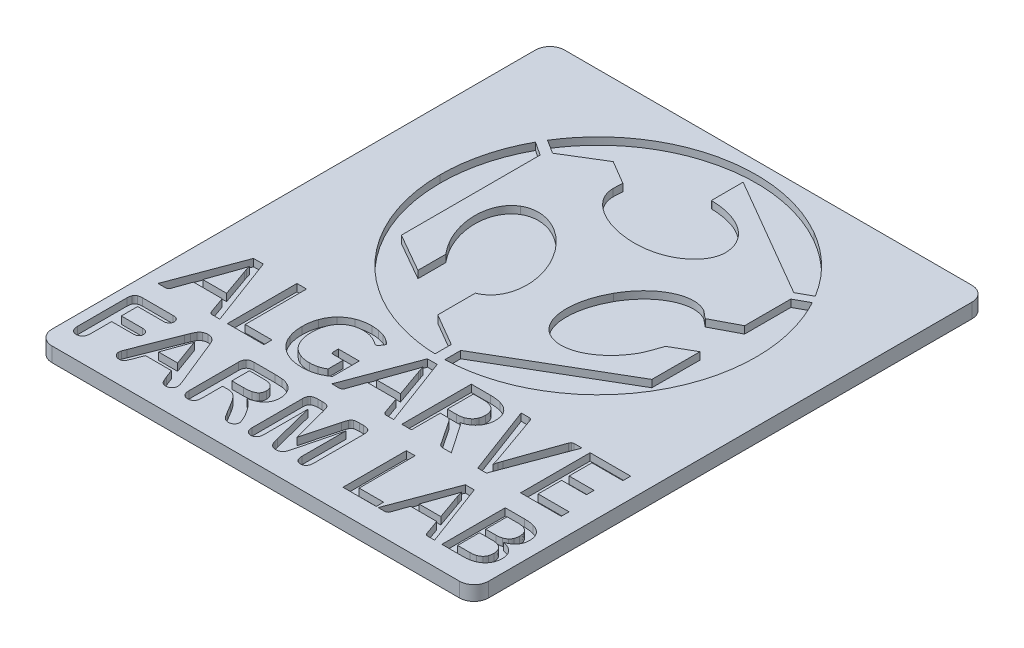
from build123d import *

# Parameters (mm, degrees)
BOSS_EXTRUDE1_DEPTH   = 0.5
BOSS_EXTRUDE1_2_DEPTH = 0.5
BOSS_EXTRUDE1_3_DEPTH = 0.5
BOSS_EXTRUDE1_4_DEPTH = 0.5
BOSS_EXTRUDE1_5_DEPTH = 0.5
BOSS_EXTRUDE1_6_DEPTH = 0.5
BOSS_EXTRUDE1_7_DEPTH = 0.5
BOSS_EXTRUDE1_8_DEPTH = 0.5
BOSS_EXTRUDE1_9_DEPTH = 0.5
BOSS_EXTRUDE2_DEPTH   = 0.5


with BuildPart() as part:
    # Sketch2 → Boss-Extrude1 (new body)
    with BuildSketch(Plane(origin=(0, 0, 0), x_dir=(1, 0, 0), z_dir=(0, 1, 0))):
        Polygon((124.769989054, 295.813345853), (124.120719075, 294.003169154), (125.431226892, 294.003169154), align=None)
    extrude(amount=BOSS_EXTRUDE1_DEPTH)



with BuildPart() as body_2:
    # Sketch2 → Boss-Extrude1 2 (new body)
    with BuildSketch(Plane(origin=(0, 0, 0), x_dir=(1, 0, 0), z_dir=(0, 1, 0))):
        with BuildLine():
            add(Edge.make_bspline(
                [(129.793601653, 295.942002339), (129.689877921, 295.985886013), (129.485422708, 296.00782766), (129.180235632, 296.00782766)],
                knots=[0, 0, 0, 0, 1, 1, 1, 1], degree=3))
            Line((129.180235632, 296.00782766), (128.360420708, 296.00782766))
            Line((128.360420708, 296.00782766), (128.360420708, 294.802040992))
            Line((128.360420708, 294.802040992), (129.156299152, 294.802040992))
            add(Edge.make_bspline(
                [(129.156299152, 294.802040992), (129.369730736, 294.802040992), (129.549252433, 294.819992971), (129.694864243, 294.855896929)],
                knots=[0, 0, 0, 0, 1, 1, 1, 1], degree=3))
            add(Edge.make_bspline(
                [(129.694864243, 294.855896929), (129.840476434, 294.893796103), (129.951181703, 294.956629173), (130.026979668, 295.044394997)],
                knots=[0, 0, 0, 0, 1, 1, 1, 1], degree=3))
            add(Edge.make_bspline(
                [(130.026979668, 295.044394997), (130.104772086, 295.134155274), (130.143668295, 295.256828021), (130.143668295, 295.412413619)],
                knots=[0, 0, 0, 0, 1, 1, 1, 1], degree=3))
            add(Edge.make_bspline(
                [(130.143668295, 295.412413619), (130.143668295, 295.53408933), (130.112750659, 295.640804931), (130.050915387, 295.732561185)],
                knots=[0, 0, 0, 0, 1, 1, 1, 1], degree=3))
            add(Edge.make_bspline(
                [(130.050915387, 295.732561185), (129.989080114, 295.826311129), (129.903308743, 295.896124974), (129.793601653, 295.942002339)],
                knots=[0, 0, 0, 0, 1, 1, 1, 1], degree=3))
        make_face()
    extrude(amount=BOSS_EXTRUDE1_2_DEPTH)


with BuildPart() as body_3:
    # Sketch2 → Boss-Extrude1 3 (new body)
    with BuildSketch(Plane(origin=(0, 0, 0), x_dir=(1, 0, 0), z_dir=(0, 1, 0))):
        with BuildLine():
            Line((142.737843878, 295.656010395), (142.121394171, 293.906089407))
            Line((142.121394171, 293.906089407), (143.612804753, 293.906089407))
            Line((143.612804753, 293.906089407), (142.996355427, 295.659325339))
            add(Edge.make_bspline(
                [(142.996355427, 295.659325339), (142.974260243, 295.712353398), (142.95216506, 295.774219149), (142.930069877, 295.844922973)],
                knots=[0, 0, 0, 0, 1, 1, 1, 1], degree=3))
            add(Edge.make_bspline(
                [(142.930069877, 295.844922973), (142.907975456, 295.915626417), (142.886985508, 295.991854132), (142.867099652, 296.073605358)],
                knots=[0, 0, 0, 0, 1, 1, 1, 1], degree=3))
            add(Edge.make_bspline(
                [(142.867099652, 296.073605358), (142.845004469, 295.989644804), (142.822909667, 295.912312234), (142.800815246, 295.841608029)],
                knots=[0, 0, 0, 0, 1, 1, 1, 1], degree=3))
            add(Edge.make_bspline(
                [(142.800815246, 295.841608029), (142.778720062, 295.770904205), (142.757729733, 295.709038453), (142.737843878, 295.656010395)],
                knots=[0, 0, 0, 0, 1, 1, 1, 1], degree=3))
        make_face()
    extrude(amount=BOSS_EXTRUDE1_3_DEPTH)


with BuildPart() as body_4:
    # Sketch2 → Boss-Extrude1 4 (new body)
    with BuildSketch(Plane(origin=(0, 0, 0), x_dir=(1, 0, 0), z_dir=(0, 1, 0))):
        with BuildLine():
            Line((146.764651496, 294.270656692), (145.906262676, 294.270656692))
            Line((145.906262676, 294.270656692), (145.906262676, 292.765989382))
            Line((145.906262676, 292.765989382), (146.764651496, 292.765989382))
            add(Edge.make_bspline(
                [(146.764651496, 292.765989382), (146.917107308, 292.765989382), (147.047467556, 292.784770383), (147.155732239, 292.822332004)],
                knots=[0, 0, 0, 0, 1, 1, 1, 1], degree=3))
            add(Edge.make_bspline(
                [(147.155732239, 292.822332004), (147.266207013, 292.862102572), (147.355691838, 292.916234723), (147.424186335, 292.984729219)],
                knots=[0, 0, 0, 0, 1, 1, 1, 1], degree=3))
            add(Edge.make_bspline(
                [(147.424186335, 292.984729219), (147.494890159, 293.053223716), (147.545708509, 293.134975322), (147.576642146, 293.229983277)],
                knots=[0, 0, 0, 0, 1, 1, 1, 1], degree=3))
            add(Edge.make_bspline(
                [(147.576642146, 293.229983277), (147.609783969, 293.327201321), (147.62635488, 293.432152584), (147.62635488, 293.544837447)],
                knots=[0, 0, 0, 0, 1, 1, 1, 1], degree=3))
            add(Edge.make_bspline(
                [(147.62635488, 293.544837447), (147.62635488, 293.767996322), (147.555651056, 293.944755883), (147.414243788, 294.075116511)],
                knots=[0, 0, 0, 0, 1, 1, 1, 1], degree=3))
            add(Edge.make_bspline(
                [(147.414243788, 294.075116511), (147.275045467, 294.205476378), (147.058514576, 294.270656692), (146.764651496, 294.270656692)],
                knots=[0, 0, 0, 0, 1, 1, 1, 1], degree=3))
        make_face()
    extrude(amount=BOSS_EXTRUDE1_4_DEPTH)


with BuildPart() as body_5:
    # Sketch2 → Boss-Extrude1 5 (new body)
    with BuildSketch(Plane(origin=(0, 0, 0), x_dir=(1, 0, 0), z_dir=(0, 1, 0))):
        with BuildLine():
            Line((145.906262676, 296.169718547), (145.906262676, 294.69488002))
            Line((145.906262676, 294.69488002), (146.608881883, 294.69488002))
            add(Edge.make_bspline(
                [(146.608881883, 294.69488002), (146.756918277, 294.69488002), (146.886174052, 294.712556166), (146.996648825, 294.747908079)],
                knots=[0, 0, 0, 0, 1, 1, 1, 1], degree=3))
            add(Edge.make_bspline(
                [(146.996648825, 294.747908079), (147.107123598, 294.785468938), (147.198817751, 294.836287288), (147.271731666, 294.900362748)],
                knots=[0, 0, 0, 0, 1, 1, 1, 1], degree=3))
            add(Edge.make_bspline(
                [(147.271731666, 294.900362748), (147.344644437, 294.964437826), (147.398776969, 295.041770396), (147.434128881, 295.132360076)],
                knots=[0, 0, 0, 0, 1, 1, 1, 1], degree=3))
            add(Edge.make_bspline(
                [(147.434128881, 295.132360076), (147.471690502, 295.222949756), (147.490471503, 295.323481982), (147.490471503, 295.433956756)],
                knots=[0, 0, 0, 0, 1, 1, 1, 1], degree=3))
            add(Edge.make_bspline(
                [(147.490471503, 295.433956756), (147.490471503, 295.688048125), (147.420872533, 295.873645759), (147.281674212, 295.990749659)],
                knots=[0, 0, 0, 0, 1, 1, 1, 1], degree=3))
            add(Edge.make_bspline(
                [(147.281674212, 295.990749659), (147.144685219, 296.110062124), (146.928154328, 296.169718547), (146.632081921, 296.169718547)],
                knots=[0, 0, 0, 0, 1, 1, 1, 1], degree=3))
            Line((146.632081921, 296.169718547), (145.906262676, 296.169718547))
        make_face()
    extrude(amount=BOSS_EXTRUDE1_5_DEPTH)


with BuildPart() as body_6:
    # Sketch2 → Boss-Extrude1 6 (new body)
    with BuildSketch(Plane(origin=(0, 0, 0), x_dir=(1, 0, 0), z_dir=(0, 1, 0))):
        with BuildLine():
            Line((122.009482463, 301.751258761), (121.333550182, 299.832485982))
            Line((121.333550182, 299.832485982), (122.968869454, 299.832485982))
            Line((122.968869454, 299.832485982), (122.292937173, 301.75489295))
            add(Edge.make_bspline(
                [(122.292937173, 301.75489295), (122.268710182, 301.813037968), (122.244483592, 301.880873623), (122.220256601, 301.958399512)],
                knots=[0, 0, 0, 0, 1, 1, 1, 1], degree=3))
            add(Edge.make_bspline(
                [(122.220256601, 301.958399512), (122.196029611, 302.035925802), (122.17301415, 302.11950854), (122.151210219, 302.209148125)],
                knots=[0, 0, 0, 0, 1, 1, 1, 1], degree=3))
            add(Edge.make_bspline(
                [(122.151210219, 302.209148125), (122.126982827, 302.117085881), (122.102755435, 302.032291613), (122.078528846, 301.954765323)],
                knots=[0, 0, 0, 0, 1, 1, 1, 1], degree=3))
            add(Edge.make_bspline(
                [(122.078528846, 301.954765323), (122.054301855, 301.877239033), (122.031286394, 301.809403779), (122.009482463, 301.751258761)],
                knots=[0, 0, 0, 0, 1, 1, 1, 1], degree=3))
        make_face()
    extrude(amount=BOSS_EXTRUDE1_6_DEPTH)


with BuildPart() as body_7:
    # Sketch2 → Boss-Extrude1 7 (new body)
    with BuildSketch(Plane(origin=(0, 0, 0), x_dir=(1, 0, 0), z_dir=(0, 1, 0))):
        with BuildLine():
            Line((133.958206973, 301.751258761), (133.282274692, 299.832485982))
            Line((133.282274692, 299.832485982), (134.917592761, 299.832485982))
            Line((134.917592761, 299.832485982), (134.241661683, 301.75489295))
            add(Edge.make_bspline(
                [(134.241661683, 301.75489295), (134.217435093, 301.813037968), (134.193208102, 301.880873623), (134.168981112, 301.958399512)],
                knots=[0, 0, 0, 0, 1, 1, 1, 1], degree=3))
            add(Edge.make_bspline(
                [(134.168981112, 301.958399512), (134.144754522, 302.035925802), (134.12173866, 302.11950854), (134.099933927, 302.209148125)],
                knots=[0, 0, 0, 0, 1, 1, 1, 1], degree=3))
            add(Edge.make_bspline(
                [(134.099933927, 302.209148125), (134.075706936, 302.117085881), (134.051480347, 302.032291613), (134.027253356, 301.954765323)],
                knots=[0, 0, 0, 0, 1, 1, 1, 1], degree=3))
            add(Edge.make_bspline(
                [(134.027253356, 301.954765323), (134.003026365, 301.877239033), (133.980011305, 301.809403779), (133.958206973, 301.751258761)],
                knots=[0, 0, 0, 0, 1, 1, 1, 1], degree=3))
        make_face()
    extrude(amount=BOSS_EXTRUDE1_7_DEPTH)


with BuildPart() as body_8:
    # Sketch2 → Boss-Extrude1 8 (new body)
    with BuildSketch(Plane(origin=(0, 0, 0), x_dir=(1, 0, 0), z_dir=(0, 1, 0))):
        with BuildLine():
            Line((137.443251438, 302.314534793), (137.443251438, 300.526587203))
            Line((137.443251438, 300.526587203), (138.064672489, 300.526587203))
            add(Edge.make_bspline(
                [(138.064672489, 300.526587203), (138.239106743, 300.526587203), (138.391736664, 300.548391535), (138.522561853, 300.592000199)],
                knots=[0, 0, 0, 0, 1, 1, 1, 1], degree=3))
            add(Edge.make_bspline(
                [(138.522561853, 300.592000199), (138.655810503, 300.63803112), (138.76725442, 300.702232586), (138.856894005, 300.784604194)],
                knots=[0, 0, 0, 0, 1, 1, 1, 1], degree=3))
            add(Edge.make_bspline(
                [(138.856894005, 300.784604194), (138.946533591, 300.866975401), (139.013157314, 300.965094494), (139.056765176, 301.078961872)],
                knots=[0, 0, 0, 0, 1, 1, 1, 1], degree=3))
            add(Edge.make_bspline(
                [(139.056765176, 301.078961872), (139.102796899, 301.195251107), (139.125812761, 301.322442107), (139.125812761, 301.460535673)],
                knots=[0, 0, 0, 0, 1, 1, 1, 1], degree=3))
            add(Edge.make_bspline(
                [(139.125812761, 301.460535673), (139.125812761, 302.029868152), (138.780578844, 302.314534793), (138.09011101, 302.314534793)],
                knots=[0, 0, 0, 0, 1, 1, 1, 1], degree=3))
            Line((138.09011101, 302.314534793), (137.443251438, 302.314534793))
        make_face()
    extrude(amount=BOSS_EXTRUDE1_8_DEPTH)


with BuildPart() as body_9:
    # Sketch2 → Boss-Extrude1 9 (new body)
    with BuildSketch(Plane(origin=(0, 0, 0), x_dir=(1, 0, 0), z_dir=(0, 1, 0))):
        with BuildLine():
            Line((148.101751423, 325.918895246), (120.101751423, 325.918895246))
            ThreePointArc((120.101751423, 325.918895246), (119.394644642, 325.626002027), (119.101751423, 324.918895246))
            Line((119.101751423, 324.918895246), (119.101751423, 291.701733425))
            ThreePointArc((119.101751423, 291.701733425), (119.394644642, 290.994626643), (120.101751423, 290.701733425))
            Line((120.101751423, 290.701733425), (148.101751423, 290.701733425))
            ThreePointArc((148.101751423, 290.701733425), (148.808858204, 290.994626643), (149.101751423, 291.701733425))
            Line((149.101751423, 291.701733425), (149.101751423, 324.918895246))
            ThreePointArc((149.101751423, 324.918895246), (148.808858204, 325.626002027), (148.101751423, 325.918895246))
        make_face()
        with BuildLine():
            add(Edge.make_bspline(
                [(122.765331691, 296.082627446), (122.697512299, 296.020792174), (122.592791531, 295.989874538), (122.451169007, 295.989874538)],
                knots=[0, 0, 0, 0, 1, 1, 1, 1], degree=3))
            Line((122.451169007, 295.989874538), (120.700832747, 295.989874538))
            Line((120.700832747, 295.989874538), (120.700832747, 294.86786517))
            Line((120.700832747, 294.86786517), (122.163933911, 294.86786517))
            add(Edge.make_bspline(
                [(122.163933911, 294.86786517), (122.299572696, 294.86786517), (122.400304177, 294.836947533), (122.466128355, 294.775112261)],
                knots=[0, 0, 0, 0, 1, 1, 1, 1], degree=3))
            add(Edge.make_bspline(
                [(122.466128355, 294.775112261), (122.533947747, 294.715271822), (122.567857253, 294.634487154), (122.567857253, 294.532758256)],
                knots=[0, 0, 0, 0, 1, 1, 1, 1], degree=3))
            add(Edge.make_bspline(
                [(122.567857253, 294.532758256), (122.567857253, 294.431028977), (122.533947747, 294.350244308), (122.466128355, 294.29040387)],
                knots=[0, 0, 0, 0, 1, 1, 1, 1], degree=3))
            add(Edge.make_bspline(
                [(122.466128355, 294.29040387), (122.398308962, 294.230563812), (122.297577481, 294.200643593), (122.163933911, 294.200643593)],
                knots=[0, 0, 0, 0, 1, 1, 1, 1], degree=3))
            Line((122.163933911, 294.200643593), (120.700832747, 294.200643593))
            Line((120.700832747, 294.200643593), (120.700832747, 292.755494027))
            add(Edge.make_bspline(
                [(120.700832747, 292.755494027), (120.700832747, 292.571983043), (120.658944668, 292.435347223), (120.57516813, 292.345586946)],
                knots=[0, 0, 0, 0, 1, 1, 1, 1], degree=3))
            add(Edge.make_bspline(
                [(120.57516813, 292.345586946), (120.493386045, 292.257821121), (120.387667861, 292.213937828), (120.258013196, 292.213937828)],
                knots=[0, 0, 0, 0, 1, 1, 1, 1], degree=3))
            add(Edge.make_bspline(
                [(120.258013196, 292.213937828), (120.126363697, 292.213937828), (120.018650679, 292.258818157), (119.934874522, 292.348578434)],
                knots=[0, 0, 0, 0, 1, 1, 1, 1], degree=3))
            add(Edge.make_bspline(
                [(119.934874522, 292.348578434), (119.853092437, 292.438339473), (119.812201394, 292.573977877), (119.812201394, 292.755494027)],
                knots=[0, 0, 0, 0, 1, 1, 1, 1], degree=3))
            Line((119.812201394, 292.755494027), (119.812201394, 296.130500788))
            add(Edge.make_bspline(
                [(119.812201394, 296.130500788), (119.812201394, 296.258160619), (119.83115079, 296.36188397), (119.869049583, 296.441671221)],
                knots=[0, 0, 0, 0, 1, 1, 1, 1], degree=3))
            add(Edge.make_bspline(
                [(119.869049583, 296.441671221), (119.906948756, 296.523453307), (119.965792158, 296.582296328), (120.04557941, 296.618200287)],
                knots=[0, 0, 0, 0, 1, 1, 1, 1], degree=3))
            add(Edge.make_bspline(
                [(120.04557941, 296.618200287), (120.127361495, 296.65609946), (120.231084846, 296.675049237), (120.356749844, 296.675049237)],
                knots=[0, 0, 0, 0, 1, 1, 1, 1], degree=3))
            Line((120.356749844, 296.675049237), (122.451169007, 296.675049237))
            add(Edge.make_bspline(
                [(122.451169007, 296.675049237), (122.592791531, 296.675049237), (122.697512299, 296.643134184), (122.765331691, 296.579304078)],
                knots=[0, 0, 0, 0, 1, 1, 1, 1], degree=3))
            add(Edge.make_bspline(
                [(122.765331691, 296.579304078), (122.835145155, 296.517468805), (122.870051697, 296.435686339), (122.870051697, 296.333957441)],
                knots=[0, 0, 0, 0, 1, 1, 1, 1], degree=3))
            add(Edge.make_bspline(
                [(122.870051697, 296.333957441), (122.870051697, 296.230234471), (122.835145155, 296.146457933), (122.765331691, 296.082627446)],
                knots=[0, 0, 0, 0, 1, 1, 1, 1], degree=3))
        make_face(mode=Mode.SUBTRACT)
        with BuildLine():
            add(Edge.make_bspline(
                [(125.978767972, 292.549045123), (125.940868418, 292.6388054), (125.907955948, 292.717594854), (125.880030182, 292.785414246)],
                knots=[0, 0, 0, 0, 1, 1, 1, 1], degree=3))
            Line((125.880030182, 292.785414246), (125.670588646, 293.335947577))
            Line((125.670588646, 293.335947577), (123.887341059, 293.335947577))
            Line((123.887341059, 293.335947577), (123.677898762, 292.773446006))
            add(Edge.make_bspline(
                [(123.677898762, 292.773446006), (123.596117058, 292.554031064), (123.526303213, 292.405427003), (123.468457227, 292.327634204)],
                knots=[0, 0, 0, 0, 1, 1, 1, 1], degree=3))
            add(Edge.make_bspline(
                [(123.468457227, 292.327634204), (123.410611622, 292.25183662), (123.31586426, 292.213937828), (123.184214762, 292.213937828)],
                knots=[0, 0, 0, 0, 1, 1, 1, 1], degree=3))
            add(Edge.make_bspline(
                [(123.184214762, 292.213937828), (123.072512457, 292.213937828), (122.97377581, 292.254828871), (122.888003676, 292.336611337)],
                knots=[0, 0, 0, 0, 1, 1, 1, 1], degree=3))
            add(Edge.make_bspline(
                [(122.888003676, 292.336611337), (122.802232685, 292.41839266), (122.759346809, 292.511145188), (122.759346809, 292.61486892)],
                knots=[0, 0, 0, 0, 1, 1, 1, 1], degree=3))
            add(Edge.make_bspline(
                [(122.759346809, 292.61486892), (122.759346809, 292.674709358), (122.769320216, 292.736544631), (122.789267028, 292.800375118)],
                knots=[0, 0, 0, 0, 1, 1, 1, 1], degree=3))
            add(Edge.make_bspline(
                [(122.789267028, 292.800375118), (122.809213841, 292.864204462), (122.842126311, 292.952968084), (122.888003676, 293.066665603)],
                knots=[0, 0, 0, 0, 1, 1, 1, 1], degree=3))
            Line((122.888003676, 293.066665603), (124.010014187, 295.915074751))
            add(Edge.make_bspline(
                [(124.010014187, 295.915074751), (124.04192924, 295.996856837), (124.079828032, 296.094596067), (124.123711706, 296.208293206)],
                knots=[0, 0, 0, 0, 1, 1, 1, 1], degree=3))
            add(Edge.make_bspline(
                [(124.123711706, 296.208293206), (124.169589071, 296.323984797), (124.21746127, 296.419729956), (124.267327921, 296.495527921)],
                knots=[0, 0, 0, 0, 1, 1, 1, 1], degree=3))
            add(Edge.make_bspline(
                [(124.267327921, 296.495527921), (124.319190168, 296.571325505), (124.386012525, 296.632163361), (124.46779461, 296.678041487)],
                knots=[0, 0, 0, 0, 1, 1, 1, 1], degree=3))
            add(Edge.make_bspline(
                [(124.46779461, 296.678041487), (124.551570767, 296.725913305), (124.654296701, 296.749849404), (124.775972412, 296.749849404)],
                knots=[0, 0, 0, 0, 1, 1, 1, 1], degree=3))
            add(Edge.make_bspline(
                [(124.775972412, 296.749849404), (124.899643337, 296.749849404), (125.002369652, 296.725913305), (125.084151738, 296.678041487)],
                knots=[0, 0, 0, 0, 1, 1, 1, 1], degree=3))
            add(Edge.make_bspline(
                [(125.084151738, 296.678041487), (125.167927895, 296.632163361), (125.23474987, 296.572322541), (125.284617283, 296.498519409)],
                knots=[0, 0, 0, 0, 1, 1, 1, 1], degree=3))
            add(Edge.make_bspline(
                [(125.284617283, 296.498519409), (125.336478768, 296.424715897), (125.379364264, 296.344928645), (125.41327415, 296.259157655)],
                knots=[0, 0, 0, 0, 1, 1, 1, 1], degree=3))
            add(Edge.make_bspline(
                [(125.41327415, 296.259157655), (125.44917849, 296.175380736), (125.4940592, 296.062680633), (125.547915518, 295.921058109)],
                knots=[0, 0, 0, 0, 1, 1, 1, 1], degree=3))
            Line((125.547915518, 295.921058109), (126.693861748, 293.090600941))
            add(Edge.make_bspline(
                [(126.693861748, 293.090600941), (126.783622787, 292.875175285), (126.828503116, 292.718592652), (126.828503116, 292.620853802)],
                knots=[0, 0, 0, 0, 1, 1, 1, 1], degree=3))
            add(Edge.make_bspline(
                [(126.828503116, 292.620853802), (126.828503116, 292.519124904), (126.785617621, 292.425374197), (126.699846249, 292.339602445)],
                knots=[0, 0, 0, 0, 1, 1, 1, 1], degree=3))
            add(Edge.make_bspline(
                [(126.699846249, 292.339602445), (126.61606933, 292.255826288), (126.514340432, 292.213937828), (126.394659554, 292.213937828)],
                knots=[0, 0, 0, 0, 1, 1, 1, 1], degree=3))
            add(Edge.make_bspline(
                [(126.394659554, 292.213937828), (126.324845328, 292.213937828), (126.265004509, 292.226903485), (126.215137095, 292.252834037)],
                knots=[0, 0, 0, 0, 1, 1, 1, 1], degree=3))
            add(Edge.make_bspline(
                [(126.215137095, 292.252834037), (126.165270444, 292.276770136), (126.123382366, 292.309682225), (126.08947286, 292.351570685)],
                knots=[0, 0, 0, 0, 1, 1, 1, 1], degree=3))
            add(Edge.make_bspline(
                [(126.08947286, 292.351570685), (126.055562973, 292.395453978), (126.018661598, 292.461278918), (125.978767972, 292.549045123)],
                knots=[0, 0, 0, 0, 1, 1, 1, 1], degree=3))
        make_face(mode=Mode.SUBTRACT)
        with BuildLine():
            add(Edge.make_bspline(
                [(129.063547386, 294.101906945), (128.959823655, 294.143794642), (128.829171573, 294.164738491), (128.671591142, 294.164738491)],
                knots=[0, 0, 0, 0, 1, 1, 1, 1], degree=3))
            Line((128.671591142, 294.164738491), (128.360420708, 294.164738491))
            Line((128.360420708, 294.164738491), (128.360420708, 292.755494027))
            add(Edge.make_bspline(
                [(128.360420708, 292.755494027), (128.360420708, 292.569988972), (128.319529665, 292.433353151), (128.23774758, 292.345586946)],
                knots=[0, 0, 0, 0, 1, 1, 1, 1], degree=3))
            add(Edge.make_bspline(
                [(128.23774758, 292.345586946), (128.155965495, 292.257821121), (128.049249513, 292.213937828), (127.917600014, 292.213937828)],
                knots=[0, 0, 0, 0, 1, 1, 1, 1], degree=3))
            add(Edge.make_bspline(
                [(127.917600014, 292.213937828), (127.77597749, 292.213937828), (127.666270019, 292.259815574), (127.588477601, 292.351570685)],
                knots=[0, 0, 0, 0, 1, 1, 1, 1], degree=3))
            add(Edge.make_bspline(
                [(127.588477601, 292.351570685), (127.510684803, 292.443325795), (127.471788213, 292.577967163), (127.471788213, 292.755494027)],
                knots=[0, 0, 0, 0, 1, 1, 1, 1], degree=3))
            Line((127.471788213, 292.755494027), (127.471788213, 296.130500788))
            add(Edge.make_bspline(
                [(127.471788213, 296.130500788), (127.471788213, 296.321989963), (127.514674089, 296.460620617), (127.600446223, 296.54639237)],
                knots=[0, 0, 0, 0, 1, 1, 1, 1], degree=3))
            add(Edge.make_bspline(
                [(127.600446223, 296.54639237), (127.686217213, 296.632163742), (127.824847868, 296.675049237), (128.016337805, 296.675049237)],
                knots=[0, 0, 0, 0, 1, 1, 1, 1], degree=3))
            Line((128.016337805, 296.675049237), (129.461485847, 296.675049237))
            add(Edge.make_bspline(
                [(129.461485847, 296.675049237), (129.660954737, 296.675049237), (129.831500445, 296.666073247), (129.973122969, 296.648121268)],
                knots=[0, 0, 0, 0, 1, 1, 1, 1], degree=3))
            add(Edge.make_bspline(
                [(129.973122969, 296.648121268), (130.114745493, 296.632163742), (130.242405324, 296.598253855), (130.356102081, 296.54639237)],
                knots=[0, 0, 0, 0, 1, 1, 1, 1], degree=3))
            add(Edge.make_bspline(
                [(130.356102081, 296.54639237), (130.4937357, 296.488546384), (130.615411411, 296.405766501), (130.721129214, 296.298053864)],
                knots=[0, 0, 0, 0, 1, 1, 1, 1], degree=3))
            add(Edge.make_bspline(
                [(130.721129214, 296.298053864), (130.826848161, 296.190340845), (130.906635793, 296.064675848), (130.960492112, 295.921058109)],
                knots=[0, 0, 0, 0, 1, 1, 1, 1], degree=3))
            add(Edge.make_bspline(
                [(130.960492112, 295.921058109), (131.016342883, 295.779435585), (131.044267888, 295.628837072), (131.044267888, 295.469262569)],
                knots=[0, 0, 0, 0, 1, 1, 1, 1], degree=3))
            add(Edge.make_bspline(
                [(131.044267888, 295.469262569), (131.044267888, 295.142134228), (130.95151536, 294.880830446), (130.766010305, 294.685351603)],
                knots=[0, 0, 0, 0, 1, 1, 1, 1], degree=3))
            add(Edge.make_bspline(
                [(130.766010305, 294.685351603), (130.582499322, 294.489872379), (130.303243179, 294.351242106), (129.928242259, 294.26945964)],
                knots=[0, 0, 0, 0, 1, 1, 1, 1], degree=3))
            add(Edge.make_bspline(
                [(129.928242259, 294.26945964), (130.085822309, 294.185682721), (130.236421204, 294.062012557), (130.380038561, 293.898449149)],
                knots=[0, 0, 0, 0, 1, 1, 1, 1], degree=3))
            add(Edge.make_bspline(
                [(130.380038561, 293.898449149), (130.5236563, 293.734884597), (130.65131575, 293.560349603), (130.763017674, 293.374843786)],
                knots=[0, 0, 0, 0, 1, 1, 1, 1], degree=3))
            add(Edge.make_bspline(
                [(130.763017674, 293.374843786), (130.876714812, 293.191332422), (130.964481017, 293.024776382), (131.02631629, 292.875174904)],
                knots=[0, 0, 0, 0, 1, 1, 1, 1], degree=3))
            add(Edge.make_bspline(
                [(131.02631629, 292.875174904), (131.090146396, 292.72756826), (131.122061449, 292.625839743), (131.122061449, 292.569989353)],
                knots=[0, 0, 0, 0, 1, 1, 1, 1], degree=3))
            add(Edge.make_bspline(
                [(131.122061449, 292.569989353), (131.122061449, 292.512142986), (131.103111672, 292.454297), (131.065212499, 292.396451395)],
                knots=[0, 0, 0, 0, 1, 1, 1, 1], degree=3))
            add(Edge.make_bspline(
                [(131.065212499, 292.396451395), (131.02930854, 292.340600242), (130.979441508, 292.29671733), (130.915611402, 292.264802277)],
                knots=[0, 0, 0, 0, 1, 1, 1, 1], degree=3))
            add(Edge.make_bspline(
                [(130.915611402, 292.264802277), (130.851780915, 292.230892772), (130.777977783, 292.213937828), (130.694201626, 292.213937828)],
                knots=[0, 0, 0, 0, 1, 1, 1, 1], degree=3))
            add(Edge.make_bspline(
                [(130.694201626, 292.213937828), (130.594467562, 292.213937828), (130.510690643, 292.237874308), (130.442871632, 292.285746507)],
                knots=[0, 0, 0, 0, 1, 1, 1, 1], degree=3))
            add(Edge.make_bspline(
                [(130.442871632, 292.285746507), (130.375052239, 292.331624253), (130.316208836, 292.390467275), (130.266341423, 292.462275572)],
                knots=[0, 0, 0, 0, 1, 1, 1, 1], degree=3))
            add(Edge.make_bspline(
                [(130.266341423, 292.462275572), (130.218468844, 292.534084632), (130.152644285, 292.639803198), (130.068867366, 292.779430888)],
                knots=[0, 0, 0, 0, 1, 1, 1, 1], degree=3))
            Line((130.068867366, 292.779430888), (129.712816984, 293.371851155))
            add(Edge.make_bspline(
                [(129.712816984, 293.371851155), (129.585156772, 293.589272025), (129.470461836, 293.754831029), (129.368732938, 293.868528929)],
                knots=[0, 0, 0, 0, 1, 1, 1, 1], degree=3))
            add(Edge.make_bspline(
                [(129.368732938, 293.868528929), (129.268998874, 293.982225687), (129.167270356, 294.060018485), (129.063547386, 294.101906945)],
                knots=[0, 0, 0, 0, 1, 1, 1, 1], degree=3))
        make_face(mode=Mode.SUBTRACT)
        with BuildLine():
            add(Edge.make_bspline(
                [(133.431905506, 292.683685348), (133.409963859, 292.769457482), (133.387025177, 292.858220723), (133.363089077, 292.949975833)],
                knots=[0, 0, 0, 0, 1, 1, 1, 1], degree=3))
            Line((133.363089077, 292.949975833), (132.65996278, 295.744529425))
            Line((132.65996278, 295.744529425), (132.65996278, 292.716597818))
            add(Edge.make_bspline(
                [(132.65996278, 292.716597818), (132.65996278, 292.549044742), (132.622063607, 292.423379364), (132.546265261, 292.339602445)],
                knots=[0, 0, 0, 0, 1, 1, 1, 1], degree=3))
            add(Edge.make_bspline(
                [(132.546265261, 292.339602445), (132.472462129, 292.255826288), (132.373725101, 292.213937828), (132.250054556, 292.213937828)],
                knots=[0, 0, 0, 0, 1, 1, 1, 1], degree=3))
            add(Edge.make_bspline(
                [(132.250054556, 292.213937828), (132.130373679, 292.213937828), (132.032634067, 292.254828871), (131.956836102, 292.336611337)],
                knots=[0, 0, 0, 0, 1, 1, 1, 1], degree=3))
            add(Edge.make_bspline(
                [(131.956836102, 292.336611337), (131.881038517, 292.420387494), (131.843140106, 292.547049908), (131.843140106, 292.716597818)],
                knots=[0, 0, 0, 0, 1, 1, 1, 1], degree=3))
            Line((131.843140106, 292.716597818), (131.843140106, 296.187348976))
            add(Edge.make_bspline(
                [(131.843140106, 296.187348976), (131.843140106, 296.378838913), (131.893007138, 296.50749578), (131.992740822, 296.573320339)],
                knots=[0, 0, 0, 0, 1, 1, 1, 1], degree=3))
            add(Edge.make_bspline(
                [(131.992740822, 296.573320339), (132.092474886, 296.641139731), (132.227116254, 296.675049237), (132.396664545, 296.675049237)],
                knots=[0, 0, 0, 0, 1, 1, 1, 1], degree=3))
            Line((132.396664545, 296.675049237), (132.67193102, 296.675049237))
            add(Edge.make_bspline(
                [(132.67193102, 296.675049237), (132.837489262, 296.675049237), (132.95717014, 296.660089127), (133.030973652, 296.630168527)],
                knots=[0, 0, 0, 0, 1, 1, 1, 1], degree=3))
            add(Edge.make_bspline(
                [(133.030973652, 296.630168527), (133.106771617, 296.600248689), (133.162623151, 296.546391989), (133.19852749, 296.46859919)],
                knots=[0, 0, 0, 0, 1, 1, 1, 1], degree=3))
            add(Edge.make_bspline(
                [(133.19852749, 296.46859919), (133.23443221, 296.390806772), (133.275323253, 296.264144358), (133.321200618, 296.088612328)],
                knots=[0, 0, 0, 0, 1, 1, 1, 1], degree=3))
            Line((133.321200618, 296.088612328), (133.958502357, 293.686014982))
            Line((133.958502357, 293.686014982), (134.595803714, 296.088612328))
            add(Edge.make_bspline(
                [(134.595803714, 296.088612328), (134.641681079, 296.264144358), (134.682572122, 296.390806772), (134.718476842, 296.46859919)],
                knots=[0, 0, 0, 0, 1, 1, 1, 1], degree=3))
            add(Edge.make_bspline(
                [(134.718476842, 296.46859919), (134.754381563, 296.546391989), (134.809235298, 296.600248689), (134.88303843, 296.630168527)],
                knots=[0, 0, 0, 0, 1, 1, 1, 1], degree=3))
            add(Edge.make_bspline(
                [(134.88303843, 296.630168527), (134.958836776, 296.660089127), (135.07951507, 296.675049237), (135.245073312, 296.675049237)],
                knots=[0, 0, 0, 0, 1, 1, 1, 1], degree=3))
            Line((135.245073312, 296.675049237), (135.520340168, 296.675049237))
            add(Edge.make_bspline(
                [(135.520340168, 296.675049237), (135.689888078, 296.675049237), (135.824529446, 296.641139731), (135.92426351, 296.573320339)],
                knots=[0, 0, 0, 0, 1, 1, 1, 1], degree=3))
            add(Edge.make_bspline(
                [(135.92426351, 296.573320339), (136.023997575, 296.50749578), (136.073864607, 296.378838913), (136.073864607, 296.187348976)],
                knots=[0, 0, 0, 0, 1, 1, 1, 1], degree=3))
            Line((136.073864607, 296.187348976), (136.073864607, 292.716597818))
            add(Edge.make_bspline(
                [(136.073864607, 292.716597818), (136.073864607, 292.549044742), (136.035965815, 292.423379364), (135.960168231, 292.339602445)],
                knots=[0, 0, 0, 0, 1, 1, 1, 1], degree=3))
            add(Edge.make_bspline(
                [(135.960168231, 292.339602445), (135.886365099, 292.255826288), (135.786630654, 292.213937828), (135.660965275, 292.213937828)],
                knots=[0, 0, 0, 0, 1, 1, 1, 1], degree=3))
            add(Edge.make_bspline(
                [(135.660965275, 292.213937828), (135.543279232, 292.213937828), (135.446537037, 292.255826288), (135.370739071, 292.339602445)],
                knots=[0, 0, 0, 0, 1, 1, 1, 1], degree=3))
            add(Edge.make_bspline(
                [(135.370739071, 292.339602445), (135.294940725, 292.423379364), (135.257041552, 292.549044742), (135.257041552, 292.716597818)],
                knots=[0, 0, 0, 0, 1, 1, 1, 1], degree=3))
            Line((135.257041552, 292.716597818), (135.257041552, 295.744529425))
            Line((135.257041552, 295.744529425), (134.553915255, 292.949975833))
            add(Edge.make_bspline(
                [(134.553915255, 292.949975833), (134.508037509, 292.768459684), (134.470138336, 292.634816114), (134.440217736, 292.549045123)],
                knots=[0, 0, 0, 0, 1, 1, 1, 1], degree=3))
            add(Edge.make_bspline(
                [(134.440217736, 292.549045123), (134.412293112, 292.465267823), (134.359433829, 292.388472441), (134.28164103, 292.318658215)],
                knots=[0, 0, 0, 0, 1, 1, 1, 1], degree=3))
            add(Edge.make_bspline(
                [(134.28164103, 292.318658215), (134.203848612, 292.248844751), (134.096135594, 292.213937828), (133.958502357, 292.213937828)],
                knots=[0, 0, 0, 0, 1, 1, 1, 1], degree=3))
            add(Edge.make_bspline(
                [(133.958502357, 292.213937828), (133.854778244, 292.213937828), (133.767012419, 292.236876892), (133.695203741, 292.282754256)],
                knots=[0, 0, 0, 0, 1, 1, 1, 1], degree=3))
            add(Edge.make_bspline(
                [(133.695203741, 292.282754256), (133.623395443, 292.326637169), (133.567544291, 292.383485357), (133.527649903, 292.453299583)],
                knots=[0, 0, 0, 0, 1, 1, 1, 1], degree=3))
            add(Edge.make_bspline(
                [(133.527649903, 292.453299583), (133.487756277, 292.523113809), (133.455841605, 292.599909191), (133.431905506, 292.683685348)],
                knots=[0, 0, 0, 0, 1, 1, 1, 1], degree=3))
        make_face(mode=Mode.SUBTRACT)
        with BuildLine():
            Line((122.489175357, 302.834203365), (124.277122947, 298.059074347))
            Line((124.277122947, 298.059074347), (123.764723956, 298.059074347))
            add(Edge.make_bspline(
                [(123.764723956, 298.059074347), (123.706578938, 298.059074347), (123.659336486, 298.073610301), (123.6229962, 298.102681807)],
                knots=[0, 0, 0, 0, 1, 1, 1, 1], degree=3))
            add(Edge.make_bspline(
                [(123.6229962, 298.102681807), (123.589078574, 298.131754517), (123.562428924, 298.168095204), (123.543047251, 298.211703867)],
                knots=[0, 0, 0, 0, 1, 1, 1, 1], degree=3))
            Line((123.543047251, 298.211703867), (123.136034527, 299.360060263))
            Line((123.136034527, 299.360060263), (121.166384707, 299.360060263))
            Line((121.166384707, 299.360060263), (120.763006574, 298.215338056))
            add(Edge.make_bspline(
                [(120.763006574, 298.215338056), (120.748470219, 298.174152052), (120.72060944, 298.137811365), (120.679423436, 298.106315996)],
                knots=[0, 0, 0, 0, 1, 1, 1, 1], degree=3))
            add(Edge.make_bspline(
                [(120.679423436, 298.106315996), (120.640660491, 298.074821429), (120.593417638, 298.059074347), (120.53769568, 298.059074347)],
                knots=[0, 0, 0, 0, 1, 1, 1, 1], degree=3))
            Line((120.53769568, 298.059074347), (120.025296689, 298.059074347))
            Line((120.025296689, 298.059074347), (121.816878468, 302.834203365))
            Line((121.816878468, 302.834203365), (122.489175357, 302.834203365))
        make_face(mode=Mode.SUBTRACT)
        Polygon((125.461820832, 302.834203365), (125.461820832, 298.615082001), (127.30427885, 298.615082001), (127.30427885, 298.059074347), (124.800425707, 298.059074347), (124.800425707, 302.834203365), align=None, mode=Mode.SUBTRACT)
        with BuildLine():
            add(Edge.make_bspline(
                [(131.199969826, 302.536211498), (131.313836402, 302.461108268), (131.419223471, 302.377525531), (131.516131835, 302.285462885)],
                knots=[0, 0, 0, 0, 1, 1, 1, 1], degree=3))
            Line((131.516131835, 302.285462885), (131.330795015, 301.98747142))
            add(Edge.make_bspline(
                [(131.330795015, 301.98747142), (131.301723107, 301.939017839), (131.262960163, 301.908734001), (131.21450578, 301.896620706)],
                knots=[0, 0, 0, 0, 1, 1, 1, 1], degree=3))
            add(Edge.make_bspline(
                [(131.21450578, 301.896620706), (131.166052199, 301.884507411), (131.113964029, 301.895409176), (131.05824207, 301.929326802)],
                knots=[0, 0, 0, 0, 1, 1, 1, 1], degree=3))
            add(Edge.make_bspline(
                [(131.05824207, 301.929326802), (131.002520513, 301.960822171), (130.940742107, 301.998373586), (130.872906453, 302.041981848)],
                knots=[0, 0, 0, 0, 1, 1, 1, 1], degree=3))
            add(Edge.make_bspline(
                [(130.872906453, 302.041981848), (130.807493859, 302.088013171), (130.728756038, 302.130410706), (130.636693794, 302.16917365)],
                knots=[0, 0, 0, 0, 1, 1, 1, 1], degree=3))
            add(Edge.make_bspline(
                [(130.636693794, 302.16917365), (130.54463155, 302.210359655), (130.435610292, 302.245488411), (130.309630421, 302.274560318)],
                knots=[0, 0, 0, 0, 1, 1, 1, 1], degree=3))
            add(Edge.make_bspline(
                [(130.309630421, 302.274560318), (130.18365055, 302.303632627), (130.034654817, 302.318168982), (129.862643624, 302.318168982)],
                knots=[0, 0, 0, 0, 1, 1, 1, 1], degree=3))
            add(Edge.make_bspline(
                [(129.862643624, 302.318168982), (129.61068308, 302.318168982), (129.381738398, 302.274560719), (129.175809578, 302.187343793)],
                knots=[0, 0, 0, 0, 1, 1, 1, 1], degree=3))
            add(Edge.make_bspline(
                [(129.175809578, 302.187343793), (128.972303817, 302.100127268), (128.797869564, 301.975358526), (128.65250802, 301.813037567)],
                knots=[0, 0, 0, 0, 1, 1, 1, 1], degree=3))
            add(Edge.make_bspline(
                [(128.65250802, 301.813037567), (128.509569135, 301.650717411), (128.399336347, 301.453267696), (128.321810458, 301.220688424)],
                knots=[0, 0, 0, 0, 1, 1, 1, 1], degree=3))
            add(Edge.make_bspline(
                [(128.321810458, 301.220688424), (128.244284168, 300.990532613), (128.205521223, 300.732516024), (128.205521223, 300.446638254)],
                knots=[0, 0, 0, 0, 1, 1, 1, 1], degree=3))
            add(Edge.make_bspline(
                [(128.205521223, 300.446638254), (128.205521223, 300.148646789), (128.245495698, 299.880939162), (128.325444647, 299.643514973)],
                knots=[0, 0, 0, 0, 1, 1, 1, 1], degree=3))
            add(Edge.make_bspline(
                [(128.325444647, 299.643514973), (128.407815854, 299.408513844), (128.524105089, 299.208641471), (128.674312352, 299.043898655)],
                knots=[0, 0, 0, 0, 1, 1, 1, 1], degree=3))
            add(Edge.make_bspline(
                [(128.674312352, 299.043898655), (128.826941873, 298.881578499), (129.009855232, 298.756809757), (129.22305243, 298.669592429)],
                knots=[0, 0, 0, 0, 1, 1, 1, 1], degree=3))
            add(Edge.make_bspline(
                [(129.22305243, 298.669592429), (129.436249227, 298.584798563), (129.674884545, 298.542401429), (129.938958384, 298.542401429)],
                knots=[0, 0, 0, 0, 1, 1, 1, 1], degree=3))
            add(Edge.make_bspline(
                [(129.938958384, 298.542401429), (130.142464144, 298.542401429), (130.324166375, 298.56541689), (130.484064273, 298.611447812)],
                knots=[0, 0, 0, 0, 1, 1, 1, 1], degree=3))
            add(Edge.make_bspline(
                [(130.484064273, 298.611447812), (130.643962172, 298.659902194), (130.801437412, 298.726526319), (130.956489992, 298.811320185)],
                knots=[0, 0, 0, 0, 1, 1, 1, 1], degree=3))
            Line((130.956489992, 298.811320185), (130.956489992, 299.8579233))
            Line((130.956489992, 299.8579233), (130.269655946, 299.8579233))
            add(Edge.make_bspline(
                [(130.269655946, 299.8579233), (130.226047283, 299.8579233), (130.190918126, 299.870036996), (130.164268075, 299.894263586)],
                knots=[0, 0, 0, 0, 1, 1, 1, 1], degree=3))
            add(Edge.make_bspline(
                [(130.164268075, 299.894263586), (130.137618425, 299.918491379), (130.1242936, 299.948775217), (130.1242936, 299.985115503)],
                knots=[0, 0, 0, 0, 1, 1, 1, 1], degree=3))
            Line((130.1242936, 299.985115503), (130.1242936, 300.359421729))
            Line((130.1242936, 300.359421729), (131.55610631, 300.359421729))
            Line((131.55610631, 300.359421729), (131.55610631, 298.520597098))
            add(Edge.make_bspline(
                [(131.55610631, 298.520597098), (131.32352784, 298.348585503), (131.075201485, 298.220182973), (130.811127646, 298.135389107)],
                knots=[0, 0, 0, 0, 1, 1, 1, 1], degree=3))
            add(Edge.make_bspline(
                [(130.811127646, 298.135389107), (130.549476467, 298.050594439), (130.264810227, 298.008196904), (129.957128527, 298.008196904)],
                knots=[0, 0, 0, 0, 1, 1, 1, 1], degree=3))
            add(Edge.make_bspline(
                [(129.957128527, 298.008196904), (129.586455688, 298.008196904), (129.250912808, 298.067553052), (128.950499486, 298.186265347)],
                knots=[0, 0, 0, 0, 1, 1, 1, 1], degree=3))
            add(Edge.make_bspline(
                [(128.950499486, 298.186265347), (128.652507619, 298.304977241), (128.398124817, 298.470931987), (128.18735108, 298.684129185)],
                knots=[0, 0, 0, 0, 1, 1, 1, 1], degree=3))
            add(Edge.make_bspline(
                [(128.18735108, 298.684129185), (127.976576541, 298.899748641), (127.814255983, 299.156554102), (127.700389407, 299.454545167)],
                knots=[0, 0, 0, 0, 1, 1, 1, 1], degree=3))
            add(Edge.make_bspline(
                [(127.700389407, 299.454545167), (127.58652243, 299.754959291), (127.529588942, 300.085656853), (127.529588942, 300.446638254)],
                knots=[0, 0, 0, 0, 1, 1, 1, 1], degree=3))
            add(Edge.make_bspline(
                [(127.529588942, 300.446638254), (127.529588942, 300.810042314), (127.584099771, 301.140739876), (127.693121029, 301.438730941)],
                knots=[0, 0, 0, 0, 1, 1, 1, 1], degree=3))
            add(Edge.make_bspline(
                [(127.693121029, 301.438730941), (127.804564545, 301.739145065), (127.962039785, 301.995950927), (128.165546748, 302.209148125)],
                knots=[0, 0, 0, 0, 1, 1, 1, 1], degree=3))
            add(Edge.make_bspline(
                [(128.165546748, 302.209148125), (128.371475568, 302.424767581), (128.619801522, 302.591933457), (128.910525011, 302.710645351)],
                knots=[0, 0, 0, 0, 1, 1, 1, 1], degree=3))
            add(Edge.make_bspline(
                [(128.910525011, 302.710645351), (129.201247697, 302.829357646), (129.527099942, 302.888713793), (129.888080941, 302.888713793)],
                knots=[0, 0, 0, 0, 1, 1, 1, 1], degree=3))
            add(Edge.make_bspline(
                [(129.888080941, 302.888713793), (130.072205831, 302.888713793), (130.241794365, 302.874177438), (130.396846946, 302.845104728)],
                knots=[0, 0, 0, 0, 1, 1, 1, 1], degree=3))
            add(Edge.make_bspline(
                [(130.396846946, 302.845104728), (130.554321785, 302.818455079), (130.699683729, 302.778480604), (130.832931978, 302.725181304)],
                knots=[0, 0, 0, 0, 1, 1, 1, 1], degree=3))
            add(Edge.make_bspline(
                [(130.832931978, 302.725181304), (130.966180227, 302.674305065), (131.08852631, 302.611315129), (131.199969826, 302.536211498)],
                knots=[0, 0, 0, 0, 1, 1, 1, 1], degree=3))
        make_face(mode=Mode.SUBTRACT)
        with BuildLine():
            Line((133.765602978, 302.834203365), (134.101751423, 302.834203365))
            Line((134.101751423, 302.834203365), (134.437899867, 302.834203365))
            Line((134.437899867, 302.834203365), (136.225847457, 298.059074347))
            Line((136.225847457, 298.059074347), (135.713448867, 298.059074347))
            add(Edge.make_bspline(
                [(135.713448867, 298.059074347), (135.655303849, 298.059074347), (135.608060996, 298.073610301), (135.571720711, 298.102681807)],
                knots=[0, 0, 0, 0, 1, 1, 1, 1], degree=3))
            add(Edge.make_bspline(
                [(135.571720711, 298.102681807), (135.537802683, 298.131754517), (135.511153033, 298.168095204), (135.491771761, 298.211703867)],
                knots=[0, 0, 0, 0, 1, 1, 1, 1], degree=3))
            Line((135.491771761, 298.211703867), (135.084759439, 299.360060263))
            Line((135.084759439, 299.360060263), (133.115109619, 299.360060263))
            Line((133.115109619, 299.360060263), (132.711731485, 298.215338056))
            add(Edge.make_bspline(
                [(132.711731485, 298.215338056), (132.69719513, 298.174152052), (132.669333951, 298.137811365), (132.628147946, 298.106315996)],
                knots=[0, 0, 0, 0, 1, 1, 1, 1], degree=3))
            add(Edge.make_bspline(
                [(132.628147946, 298.106315996), (132.589385001, 298.074821429), (132.54214255, 298.059074347), (132.48642019, 298.059074347)],
                knots=[0, 0, 0, 0, 1, 1, 1, 1], degree=3))
            Line((132.48642019, 298.059074347), (131.974019996, 298.059074347))
            Line((131.974019996, 298.059074347), (133.765602978, 302.834203365))
        make_face(mode=Mode.SUBTRACT)
        Polygon((139.112061073, 296.643656132), (139.112061073, 292.795818165), (140.79238271, 292.795818165), (140.79238271, 292.288737996), (138.508868857, 292.288737996), (138.508868857, 296.643656132), align=None, mode=Mode.SUBTRACT)
        with BuildLine():
            Line((143.175325077, 296.643656132), (144.805932837, 292.288737996))
            Line((144.805932837, 292.288737996), (144.338623998, 292.288737996))
            add(Edge.make_bspline(
                [(144.338623998, 292.288737996), (144.28559632, 292.288737996), (144.242511189, 292.301995105), (144.209368223, 292.328509325)],
                knots=[0, 0, 0, 0, 1, 1, 1, 1], degree=3))
            add(Edge.make_bspline(
                [(144.209368223, 292.328509325), (144.178435729, 292.355022783), (144.154131218, 292.388165368), (144.136455452, 292.427936316)],
                knots=[0, 0, 0, 0, 1, 1, 1, 1], degree=3))
            Line((144.136455452, 292.427936316), (143.765259803, 293.475238096))
            Line((143.765259803, 293.475238096), (141.968939502, 293.475238096))
            Line((141.968939502, 293.475238096), (141.601058797, 292.431251261))
            add(Edge.make_bspline(
                [(141.601058797, 292.431251261), (141.587801306, 292.393689259), (141.56239194, 292.360546674), (141.5248307, 292.331823127)],
                knots=[0, 0, 0, 0, 1, 1, 1, 1], degree=3))
            add(Edge.make_bspline(
                [(141.5248307, 292.331823127), (141.489478788, 292.303099579), (141.446393657, 292.288737996), (141.395574926, 292.288737996)],
                knots=[0, 0, 0, 0, 1, 1, 1, 1], degree=3))
            Line((141.395574926, 292.288737996), (140.928266086, 292.288737996))
            Line((140.928266086, 292.288737996), (142.562189171, 296.643656132))
            Line((142.562189171, 296.643656132), (143.175325077, 296.643656132))
        make_face(mode=Mode.SUBTRACT)
        with BuildLine():
            Line((146.774594043, 292.288737996), (145.303069317, 292.288737996))
            Line((145.303069317, 292.288737996), (145.303069317, 296.643656132))
            Line((145.303069317, 296.643656132), (146.632081921, 296.643656132))
            add(Edge.make_bspline(
                [(146.632081921, 296.643656132), (146.88838338, 296.643656132), (147.108228072, 296.617141912), (147.291616759, 296.564114235)],
                knots=[0, 0, 0, 0, 1, 1, 1, 1], degree=3))
            add(Edge.make_bspline(
                [(147.291616759, 296.564114235), (147.477214393, 296.513295504), (147.62856497, 296.438172643), (147.745668108, 296.338745651)],
                knots=[0, 0, 0, 0, 1, 1, 1, 1], degree=3))
            add(Edge.make_bspline(
                [(147.745668108, 296.338745651), (147.864981335, 296.241527607), (147.952256071, 296.12221438), (148.007493457, 295.98080635)],
                knots=[0, 0, 0, 0, 1, 1, 1, 1], degree=3))
            add(Edge.make_bspline(
                [(148.007493457, 295.98080635), (148.062730844, 295.841608029), (148.090349918, 295.683629088), (148.090349918, 295.506869527)],
                knots=[0, 0, 0, 0, 1, 1, 1, 1], degree=3))
            add(Edge.make_bspline(
                [(148.090349918, 295.506869527), (148.090349918, 295.400814171), (148.073778626, 295.298072617), (148.040636042, 295.198645245)],
                knots=[0, 0, 0, 0, 1, 1, 1, 1], degree=3))
            add(Edge.make_bspline(
                [(148.040636042, 295.198645245), (148.009703166, 295.099217492), (147.962198998, 295.007523339), (147.898123919, 294.923562785)],
                knots=[0, 0, 0, 0, 1, 1, 1, 1], degree=3))
            add(Edge.make_bspline(
                [(147.898123919, 294.923562785), (147.83404846, 294.839602232), (147.753401707, 294.763374516), (147.656183663, 294.69488002)],
                knots=[0, 0, 0, 0, 1, 1, 1, 1], degree=3))
            add(Edge.make_bspline(
                [(147.656183663, 294.69488002), (147.558965619, 294.626385523), (147.444071809, 294.571148137), (147.311501853, 294.52916786)],
                knots=[0, 0, 0, 0, 1, 1, 1, 1], degree=3))
            add(Edge.make_bspline(
                [(147.311501853, 294.52916786), (147.614202625, 294.469511056), (147.841780916, 294.355721719), (147.994236728, 294.187799851)],
                knots=[0, 0, 0, 0, 1, 1, 1, 1], degree=3))
            add(Edge.make_bspline(
                [(147.994236728, 294.187799851), (148.148901106, 294.022088072), (148.226233295, 293.803348234), (148.226233295, 293.531579957)],
                knots=[0, 0, 0, 0, 1, 1, 1, 1], degree=3))
            add(Edge.make_bspline(
                [(148.226233295, 293.531579957), (148.226233295, 293.345982322), (148.194195565, 293.17695598), (148.130120105, 293.02450093)],
                knots=[0, 0, 0, 0, 1, 1, 1, 1], degree=3))
            add(Edge.make_bspline(
                [(148.130120105, 293.02450093), (148.066045026, 292.87204588), (147.972141545, 292.740580397), (147.848409662, 292.630104862)],
                knots=[0, 0, 0, 0, 1, 1, 1, 1], degree=3))
            add(Edge.make_bspline(
                [(147.848409662, 292.630104862), (147.72467816, 292.521840179), (147.572222729, 292.437879625), (147.39104375, 292.378223202)],
                knots=[0, 0, 0, 0, 1, 1, 1, 1], degree=3))
            add(Edge.make_bspline(
                [(147.39104375, 292.378223202), (147.212074099, 292.318566398), (147.006590991, 292.288737996), (146.774594043, 292.288737996)],
                knots=[0, 0, 0, 0, 1, 1, 1, 1], degree=3))
        make_face(mode=Mode.SUBTRACT)
        with BuildLine():
            Line((137.88660525, 300.043260121), (137.443251438, 300.043260121))
            Line((137.443251438, 300.043260121), (137.443251438, 298.059074347))
            Line((137.443251438, 298.059074347), (136.781856314, 298.059074347))
            Line((136.781856314, 298.059074347), (136.781856314, 302.834203365))
            Line((136.781856314, 302.834203365), (138.09011101, 302.834203365))
            add(Edge.make_bspline(
                [(138.09011101, 302.834203365), (138.380834498, 302.834203365), (138.631583111, 302.802707996), (138.842356848, 302.739717258)],
                knots=[0, 0, 0, 0, 1, 1, 1, 1], degree=3))
            add(Edge.make_bspline(
                [(138.842356848, 302.739717258), (139.055554047, 302.679150383), (139.2299883, 302.590721927), (139.365659609, 302.474432692)],
                knots=[0, 0, 0, 0, 1, 1, 1, 1], degree=3))
            add(Edge.make_bspline(
                [(139.365659609, 302.474432692), (139.503752775, 302.360566517), (139.605506056, 302.221261821), (139.67091865, 302.056518604)],
                knots=[0, 0, 0, 0, 1, 1, 1, 1], degree=3))
            add(Edge.make_bspline(
                [(139.67091865, 302.056518604), (139.736331245, 301.894198047), (139.769037743, 301.711284687), (139.769037743, 301.507778526)],
                knots=[0, 0, 0, 0, 1, 1, 1, 1], degree=3))
            add(Edge.make_bspline(
                [(139.769037743, 301.507778526), (139.769037743, 301.34061265), (139.743599623, 301.184348941), (139.692722982, 301.038987397)],
                knots=[0, 0, 0, 0, 1, 1, 1, 1], degree=3))
            add(Edge.make_bspline(
                [(139.692722982, 301.038987397), (139.644269402, 300.893625452), (139.572799959, 300.762799862), (139.478314655, 300.646510627)],
                knots=[0, 0, 0, 0, 1, 1, 1, 1], degree=3))
            add(Edge.make_bspline(
                [(139.478314655, 300.646510627), (139.386252411, 300.530221392), (139.272385434, 300.429679641), (139.136714125, 300.344884973)],
                knots=[0, 0, 0, 0, 1, 1, 1, 1], degree=3))
            add(Edge.make_bspline(
                [(139.136714125, 300.344884973), (139.001044019, 300.262513766), (138.847202968, 300.19952383), (138.675191374, 300.155915167)],
                knots=[0, 0, 0, 0, 1, 1, 1, 1], degree=3))
            add(Edge.make_bspline(
                [(138.675191374, 300.155915167), (138.716377379, 300.129265517), (138.755140323, 300.098981678), (138.791480609, 300.065064452)],
                knots=[0, 0, 0, 0, 1, 1, 1, 1], degree=3))
            add(Edge.make_bspline(
                [(138.791480609, 300.065064452), (138.827820895, 300.033569084), (138.862950051, 299.994806139), (138.89686848, 299.948775217)],
                knots=[0, 0, 0, 0, 1, 1, 1, 1], degree=3))
            Line((138.89686848, 299.948775217), (140.179684254, 298.059074347))
            Line((140.179684254, 298.059074347), (139.590969701, 298.059074347))
            add(Edge.make_bspline(
                [(139.590969701, 298.059074347), (139.477103125, 298.059074347), (139.38867507, 298.103894139), (139.325685134, 298.193533724)],
                knots=[0, 0, 0, 0, 1, 1, 1, 1], degree=3))
            Line((139.325685134, 298.193533724), (138.19549848, 299.894263586))
            add(Edge.make_bspline(
                [(138.19549848, 299.894263586), (138.159157793, 299.947562885), (138.119182918, 299.985115102), (138.075575056, 300.006919835)],
                knots=[0, 0, 0, 0, 1, 1, 1, 1], degree=3))
            add(Edge.make_bspline(
                [(138.075575056, 300.006919835), (138.034389051, 300.031146826), (137.971399116, 300.043260121), (137.88660525, 300.043260121)],
                knots=[0, 0, 0, 0, 1, 1, 1, 1], degree=3))
        make_face(mode=Mode.SUBTRACT)
        with BuildLine():
            Line((142.000339143, 298.059074347), (140.208757365, 302.834203365))
            Line((140.208757365, 302.834203365), (140.742960687, 302.834203365))
            add(Edge.make_bspline(
                [(140.742960687, 302.834203365), (140.801105706, 302.834203365), (140.848348157, 302.81966701), (140.884688443, 302.790594701)],
                knots=[0, 0, 0, 0, 1, 1, 1, 1], degree=3))
            add(Edge.make_bspline(
                [(140.884688443, 302.790594701), (140.921028729, 302.761521991), (140.947678378, 302.725181304), (140.964637392, 302.681572641)],
                knots=[0, 0, 0, 0, 1, 1, 1, 1], degree=3))
            Line((140.964637392, 302.681572641), (142.145700286, 299.334621743))
            add(Edge.make_bspline(
                [(142.145700286, 299.334621743), (142.174772595, 299.259518512), (142.202633775, 299.177146904), (142.229283424, 299.087507319)],
                knots=[0, 0, 0, 0, 1, 1, 1, 1], degree=3))
            add(Edge.make_bspline(
                [(142.229283424, 299.087507319), (142.258355733, 299.000290794), (142.283794254, 298.908228148), (142.305598185, 298.811320185)],
                knots=[0, 0, 0, 0, 1, 1, 1, 1], degree=3))
            add(Edge.make_bspline(
                [(142.305598185, 298.811320185), (142.324979858, 298.908228148), (142.34678459, 299.000290794), (142.37101118, 299.087507319)],
                knots=[0, 0, 0, 0, 1, 1, 1, 1], degree=3))
            add(Edge.make_bspline(
                [(142.37101118, 299.087507319), (142.39766083, 299.177146904), (142.425521609, 299.259518512), (142.454593516, 299.334621743)],
                knots=[0, 0, 0, 0, 1, 1, 1, 1], degree=3))
            Line((142.454593516, 299.334621743), (143.632023023, 302.677939655))
            add(Edge.make_bspline(
                [(143.632023023, 302.677939655), (143.646558977, 302.719124858), (143.673208627, 302.755464742), (143.711971973, 302.786960111)],
                knots=[0, 0, 0, 0, 1, 1, 1, 1], degree=3))
            add(Edge.make_bspline(
                [(143.711971973, 302.786960111), (143.750734917, 302.81845548), (143.79797777, 302.834203365), (143.853699728, 302.834203365)],
                knots=[0, 0, 0, 0, 1, 1, 1, 1], degree=3))
            Line((143.853699728, 302.834203365), (144.387903051, 302.834203365))
            Line((144.387903051, 302.834203365), (142.596321272, 298.059074347))
            Line((142.596321272, 298.059074347), (142.000339143, 298.059074347))
        make_face(mode=Mode.SUBTRACT)
        Polygon((144.943911908, 302.834203365), (147.734855152, 302.834203365), (147.734855152, 302.29636465), (145.608941221, 302.29636465), (145.608941221, 300.730094167), (147.320574051, 300.730094167), (147.320574051, 300.210425595), (145.608941221, 300.210425595), (145.608941221, 298.596911858), (147.738488138, 298.596911858), (147.734855152, 298.059074347), (144.943911908, 298.059074347), align=None, mode=Mode.SUBTRACT)
        with BuildLine():
            Line((131.506397888, 308.392147927), (131.506397888, 305.804018656))
            Line((131.506397888, 305.804018656), (133.733317167, 304.506242632))
            Line((133.733317167, 304.506242632), (133.732325004, 303.38776182))
            add(Edge.make_bspline(
                [(123.250089991, 314.231087716), (123.250089991, 308.36027398), (127.908468583, 303.580671806), (133.732325004, 303.38776182)],
                knots=[0, 0, 0, 0, 1, 1, 1, 1], degree=3))
            add(Edge.make_bspline(
                [(124.582240422, 319.444538746), (123.733039699, 317.897329507), (123.250089991, 316.120573231), (123.250089991, 314.231087716)],
                knots=[0, 0, 0, 0, 1, 1, 1, 1], degree=3))
            Line((124.582240422, 319.444538746), (125.514439974, 318.829171736))
            Line((125.514439974, 318.829171736), (125.514439974, 309.2966415))
            Line((125.514439974, 309.2966415), (128.17397773, 307.774637379))
            Line((128.17397773, 307.774637379), (128.17397773, 309.697346327))
            add(Edge.make_bspline(
                [(127.597748633, 310.502606729), (127.77104996, 310.208756362), (127.965230027, 309.939674786), (128.17397773, 309.697346327)],
                knots=[0, 0, 0, 0, 1, 1, 1, 1], degree=3))
            add(Edge.make_bspline(
                [(127.88739133, 315.118473491), (126.653442604, 314.390933079), (126.523763978, 312.324295891), (127.597748633, 310.502606729)],
                knots=[0, 0, 0, 0, 1, 1, 1, 1], degree=3))
            add(Edge.make_bspline(
                [(132.066392643, 313.13729629), (130.992328582, 314.959025154), (129.121300753, 315.8459742), (127.88739133, 315.118473491)],
                knots=[0, 0, 0, 0, 1, 1, 1, 1], degree=3))
            add(Edge.make_bspline(
                [(131.776908757, 308.521429127), (133.010857482, 309.248890134), (133.14057541, 311.31564643), (132.066392643, 313.13729629)],
                knots=[0, 0, 0, 0, 1, 1, 1, 1], degree=3))
            add(Edge.make_bspline(
                [(131.506397888, 308.392147927), (131.599280652, 308.427673307), (131.68990077, 308.47006603), (131.776908757, 308.521429127)],
                knots=[0, 0, 0, 0, 1, 1, 1, 1], degree=3))
        make_face(mode=Mode.SUBTRACT)
        with BuildLine():
            Line((140.92687383, 314.775760487), (142.69450052, 315.699703908))
            Line((142.69450052, 315.699703908), (142.69450052, 318.871921781))
            Line((142.69450052, 318.871921781), (143.64801554, 319.395517298))
            add(Edge.make_bspline(
                [(139.587618243, 304.870866243), (144.65368771, 307.837392709), (146.424291692, 314.272448172), (143.64801554, 319.395517298)],
                knots=[0, 0, 0, 0, 1, 1, 1, 1], degree=3))
            add(Edge.make_bspline(
                [(134.415527668, 303.386094713), (136.179820145, 303.435036756), (137.957092555, 303.916160546), (139.587618243, 304.870866243)],
                knots=[0, 0, 0, 0, 1, 1, 1, 1], degree=3))
            Line((134.415527668, 303.386094713), (134.411518912, 304.476909249))
            Line((134.411518912, 304.476909249), (142.701526271, 309.318313891))
            Line((142.701526271, 309.318313891), (142.710457345, 312.623703014))
            Line((142.710457345, 312.623703014), (141.204568859, 311.75314752))
            add(Edge.make_bspline(
                [(140.713243913, 310.460769843), (140.879241972, 310.758787777), (141.100929505, 311.450643998), (141.204568859, 311.75314752)],
                knots=[0, 0, 0, 0, 1, 1, 1, 1], degree=3))
            add(Edge.make_bspline(
                [(136.569133141, 308.474154593), (137.820547388, 307.777058835), (139.683874923, 308.613438435), (140.713243913, 310.460769843)],
                knots=[0, 0, 0, 0, 1, 1, 1, 1], degree=3))
            add(Edge.make_bspline(
                [(136.25932635, 313.130984784), (135.230076066, 311.283653776), (135.317838402, 309.171448462), (136.569133141, 308.474154593)],
                knots=[0, 0, 0, 0, 1, 1, 1, 1], degree=3))
            add(Edge.make_bspline(
                [(140.382161357, 315.203020319), (139.130786812, 315.900155779), (137.28853653, 314.978395597), (136.25932635, 313.130984784)],
                knots=[0, 0, 0, 0, 1, 1, 1, 1], degree=3))
            add(Edge.make_bspline(
                [(140.92687383, 314.775760487), (140.862808716, 314.786477775), (140.470439424, 315.153721354), (140.382161357, 315.203020319)],
                knots=[0, 0, 0, 0, 1, 1, 1, 1], degree=3))
        make_face(mode=Mode.SUBTRACT)
        with BuildLine():
            Line((130.043060935, 319.98802084), (128.417536568, 320.951379692))
            Line((128.417536568, 320.951379692), (125.832185675, 319.368605371))
            Line((125.832185675, 319.368605371), (124.886649267, 319.965673505))
            add(Edge.make_bspline(
                [(139.513868108, 323.639615991), (134.426046444, 326.568870164), (127.959553762, 324.916552576), (124.886649267, 319.965673505)],
                knots=[0, 0, 0, 0, 1, 1, 1, 1], degree=3))
            add(Edge.make_bspline(
                [(143.36734362, 319.883865353), (142.450227437, 321.391817971), (141.151379844, 322.696817858), (139.513868108, 323.639615991)],
                knots=[0, 0, 0, 0, 1, 1, 1, 1], degree=3))
            Line((143.36734362, 319.883865353), (142.414027113, 319.360587055))
            Line((142.414027113, 319.360587055), (134.101751423, 324.192266973))
            Line((134.101751423, 324.192266973), (134.101751423, 322.008415866))
            add(Edge.make_bspline(
                [(134.18721141, 322.006629145), (134.158676332, 322.007480644), (134.130182276, 322.008070995), (134.101751423, 322.008415866)],
                knots=[0, 0, 0, 0, 0.03987393, 0.03987393, 0.03987393, 0.03987393], degree=3))
            add(Edge.make_bspline(
                [(137.690511839, 319.389880736), (137.678444664, 320.822177897), (136.301083831, 321.943595898), (134.18721141, 322.006629145)],
                knots=[0, 0, 0, 0, 1, 1, 1, 1], degree=3))
            add(Edge.make_bspline(
                [(134.101751423, 316.826744878), (136.205195206, 316.857024619), (137.701153048, 318.133742945), (137.690511839, 319.389880736)],
                knots=[0.003369473, 0.003369473, 0.003369473, 0.003369473, 1, 1, 1, 1], degree=3))
            add(Edge.make_bspline(
                [(134.080396251, 316.826480553), (134.087521562, 316.826554381), (134.094639964, 316.826642506), (134.101751423, 316.826744878)],
                knots=[0, 0, 0, 0, 0.003369473, 0.003369473, 0.003369473, 0.003369473], degree=3))
            add(Edge.make_bspline(
                [(130.011028177, 319.32577592), (130.025913434, 317.893439457), (131.96573018, 316.804569947), (134.080396251, 316.826480553)],
                knots=[0, 0, 0, 0, 1, 1, 1, 1], degree=3))
            add(Edge.make_bspline(
                [(130.043060935, 319.98802084), (130.011028177, 319.720923991), (130.009996312, 319.426875112), (130.011028177, 319.32577592)],
                knots=[0, 0, 0, 0, 1, 1, 1, 1], degree=3))
        make_face(mode=Mode.SUBTRACT)
    extrude(amount=BOSS_EXTRUDE1_9_DEPTH)


with BuildPart() as part_1:
    add(part.part)

    add(body_2.part)  # Boss-Extrude2 merges body 2

    add(body_3.part)  # Boss-Extrude2 merges body 3

    add(body_4.part)  # Boss-Extrude2 merges body 4

    add(body_5.part)  # Boss-Extrude2 merges body 5

    add(body_6.part)  # Boss-Extrude2 merges body 6

    add(body_7.part)  # Boss-Extrude2 merges body 7

    add(body_8.part)  # Boss-Extrude2 merges body 8

    add(body_9.part)  # Boss-Extrude2 merges body 9
    # Sketch4 → Boss-Extrude2 (add)
    with BuildSketch(Plane.XZ):
        with BuildLine():
            Line((120.101751423, -325.918895246), (148.101751423, -325.918895246))
            ThreePointArc((148.101751423, -325.918895246), (148.808858204, -325.626002027), (149.101751423, -324.918895246))
            Line((149.101751423, -324.918895246), (149.101751423, -291.701733425))
            ThreePointArc((149.101751423, -291.701733425), (148.808858204, -290.994626643), (148.101751423, -290.701733425))
            Line((148.101751423, -290.701733425), (120.101751423, -290.701733425))
            ThreePointArc((120.101751423, -290.701733425), (119.394644642, -290.994626643), (119.101751423, -291.701733425))
            Line((119.101751423, -291.701733425), (119.101751423, -324.918895246))
            ThreePointArc((119.101751423, -324.918895246), (119.394644642, -325.626002027), (120.101751423, -325.918895246))
        make_face()
    extrude(amount=BOSS_EXTRUDE2_DEPTH)


solid = part_1.part
